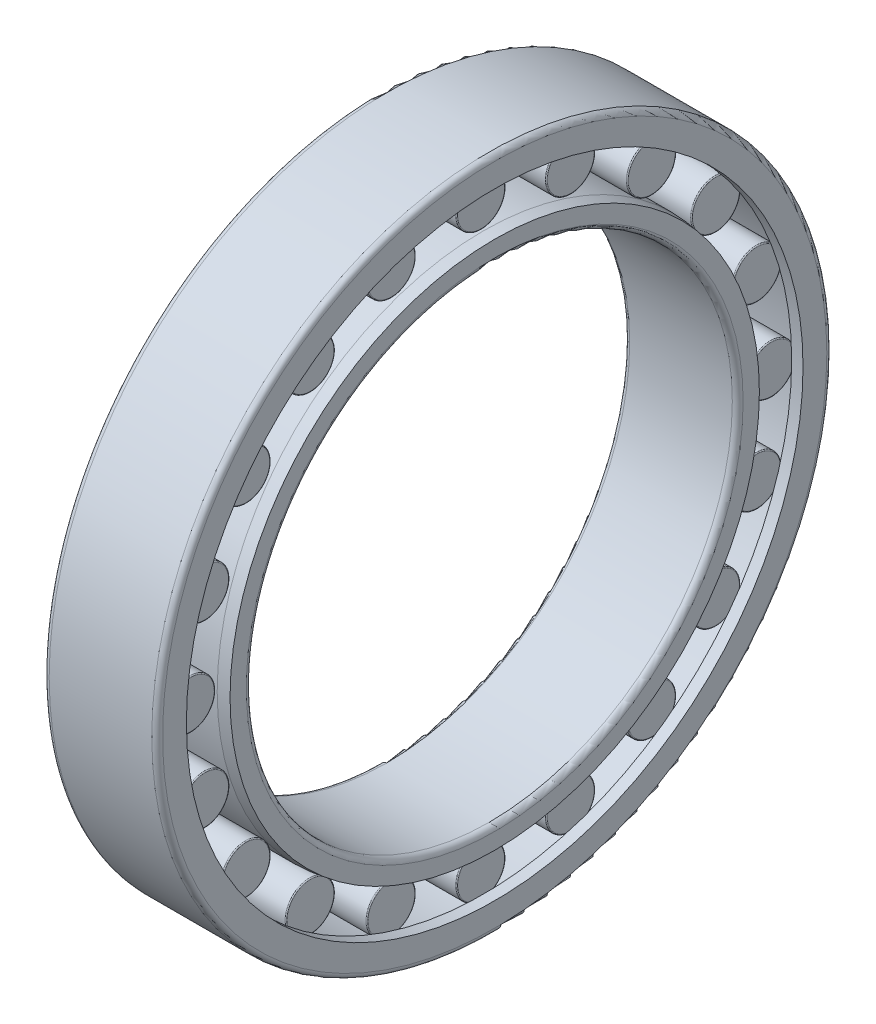
from build123d import *

# Parameters (mm, degrees)
ROLLERSDETAILED_COUNT = 20
ROLLERSDETAILED_ANGLE = 342


with BuildPart() as part:
    # OutRacSke → OuterRace (revolve)
    with BuildSketch(Plane.XY):
        with BuildLine():
            Line((-16.8, 114.18875), (-21, 114.18875))
            Line((-21, 114.18875), (-21, 123))
            ThreePointArc((-21, 123), (-20.414213562, 124.414213562), (-19, 125))
            Line((-19, 125), (19, 125))
            ThreePointArc((19, 125), (20.414213562, 124.414213562), (21, 123))
            Line((21, 123), (21, 114.18875))
            Line((21, 114.18875), (16.8, 114.18875))
            Line((16.8, 114.18875), (16.8, 116.42))
            Line((16.8, 116.42), (-16.8, 116.42))
            Line((-16.8, 116.42), (-16.8, 114.18875))
        make_face()
    revolve(axis=Axis((-90, 0, 0), (1, 0, 0)))

    # RolDetSke → RollerDetailed (revolve)
    with BuildSketch(Plane.XY):
        with BuildLine():
            Line((-15.96, 116.18512), (-15.96, 107.5))
            Line((-15.96, 107.5), (15.96, 107.5))
            Line((15.96, 107.5), (15.96, 116.18512))
            ThreePointArc((15.96, 116.18512), (15.854007802, 116.441007802), (15.59812, 116.547))
            Line((15.59812, 116.547), (-15.59812, 116.547))
            ThreePointArc((-15.59812, 116.547), (-15.854007802, 116.441007802), (-15.96, 116.18512))
        make_face()
    rollerdetailed = revolve(axis=Axis((-33.6, 107.5, 0), (1, 0, 0)))

    # InsRacSke → InnerRace (revolve)
    with BuildSketch(Plane.XY):
        with BuildLine():
            Line((-16.8, 98.58), (-21, 98.0221875))
            Line((-21, 98.0221875), (-21, 92))
            ThreePointArc((-21, 92), (-20.414213562, 90.585786438), (-19, 90))
            Line((-19, 90), (19, 90))
            ThreePointArc((19, 90), (20.414213562, 90.585786438), (21, 92))
            Line((21, 92), (21, 98.0221875))
            Line((21, 98.0221875), (16.8, 98.58))
            Line((16.8, 98.58), (-16.8, 98.58))
        make_face()
    revolve(axis=Axis((-90, 0, 0), (1, 0, 0)))

    # RollersDetailed: RollerDetailed ×20 about axis
    rollersdetailed_axis = Axis((-50, 0, 0), (1, 0, 0))
    for i in range(1, ROLLERSDETAILED_COUNT):
        add(rollerdetailed.rotate(rollersdetailed_axis, i * ROLLERSDETAILED_ANGLE / (ROLLERSDETAILED_COUNT - 1)))


solid = part.part
